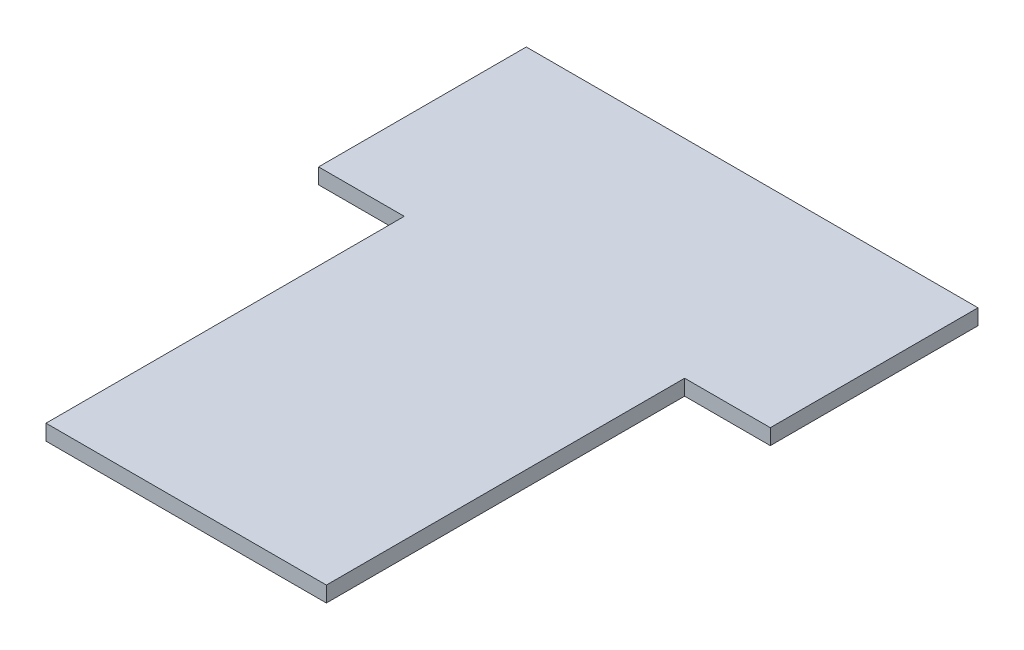
from build123d import *

# Parameters (mm, degrees)
BOSS_EXTRUDE1_DEPTH = 3


with BuildPart() as part:
    # Sketch1 → Boss-Extrude1 (new body)
    with BuildSketch(Plane(origin=(0, 0, 0), x_dir=(1, 0, 0), z_dir=(0, 1, 0))):
        Polygon((0, 0), (87, 0), (87, -40), (70.5, -40), (70.5, -109), (16.5, -109), (16.5, -40), (0, -40), align=None)
    extrude(amount=BOSS_EXTRUDE1_DEPTH)


solid = part.part
